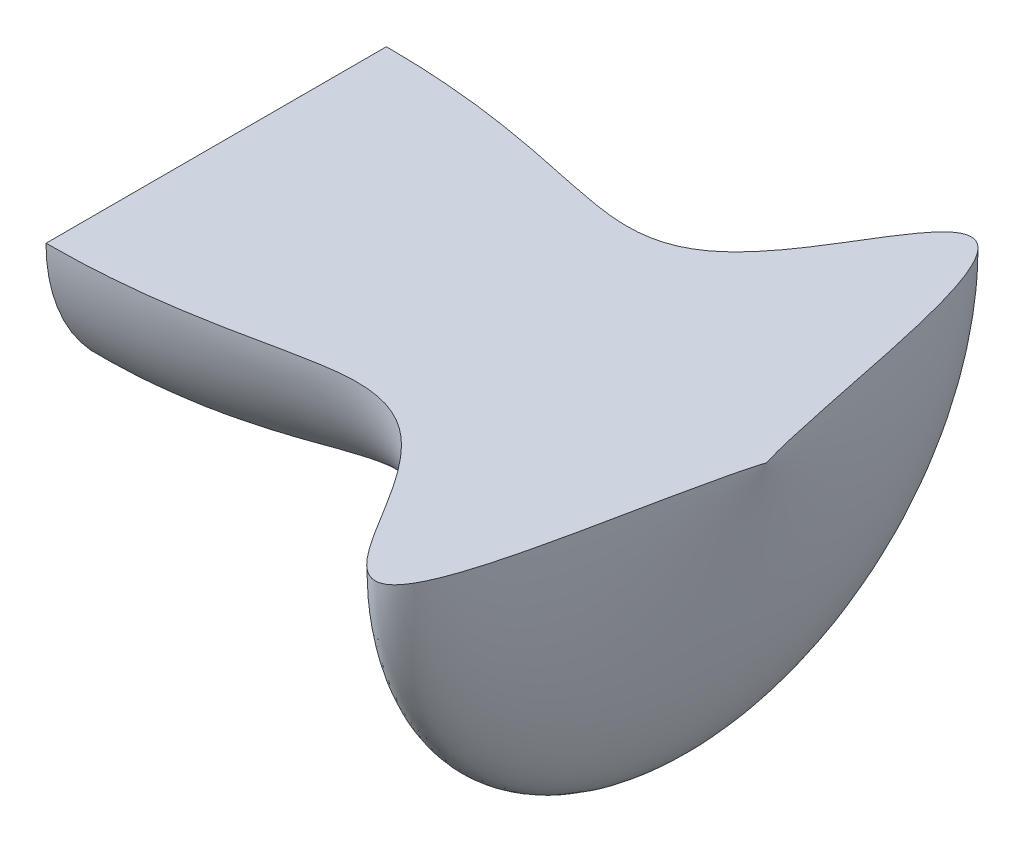
from build123d import *

# Parameters (mm, degrees)
REVOLVE1_ANGLE = 180


with BuildPart() as part:
    # Sketch1 → Revolve1 (revolve)
    with BuildSketch(Plane(origin=(0, 0, 0), x_dir=(1, 0, 0), z_dir=(0, 1, 0))):
        with BuildLine():
            Line((-1e-09, 30), (-1e-09, 0))
            add(Edge.make_bspline(
                [(-1e-09, 0), (1.321312897, 0), (3.242265014, 0.033394589), (7.425803951, 0.143758025), (11.243374319, 0.448236062), (16.297549568, 0.872990574), (21.348699818, 1.582904579), (27.560786681, 2.601501105), (34.959236381, 4.171672329), (42.400877668, 5.75468106), (50.057511122, 6.91529716), (58.417567023, 4.367021279), (63.611544574, -0.60204103), (67.676946526, -6.235020117), (71.053983589, -11.803036058), (73.694023174, -16.143365954), (76.060553172, -19.532635008), (78.002021445, -21.651683175), (80.045928537, -22.690564127), (82.055278006, -22.350646697), (84.011412973, -20.326073463), (85.655781434, -16.985217092), (87.331808566, -12.211946198), (88.873605993, -6.486723171), (90.296194306, -0.387667733), (91.649516137, 6.037034691), (92.796250523, 11.67370686), (93.78032957, 16.500318171), (94.635901341, 20.517818569), (95.348854618, 23.724168989), (96.025104288, 26.498890208), (96.546950671, 28.464925251), (96.897158627, 29.626254296), (97.013467861, 30)],
                knots=[0.054890354, 0.054890354, 0.054890354, 0.054890354, 0.054890354, 0.088622496, 0.105488567, 0.122354637, 0.156086778, 0.189818919, 0.223551068, 0.257283217, 0.323197635, 0.356929572, 0.39066128, 0.442900725, 0.476633248, 0.510365771, 0.532646149, 0.554926528, 0.566760773, 0.573363162, 0.580863143, 0.597009713, 0.626120394, 0.655231076, 0.691265525, 0.727299974, 0.763334553, 0.799369131, 0.817386702, 0.835404272, 0.853421843, 0.871439413, 0.880026072, 0.880026072, 0.880026072, 0.880026072, 0.880026072], degree=4))
            Line((97.013467861, 30), (-1e-09, 30))
        make_face()
    revolve(axis=Axis((-1e-09, 0, -30), (1, 0, 0)), revolution_arc=REVOLVE1_ANGLE)


solid = part.part
